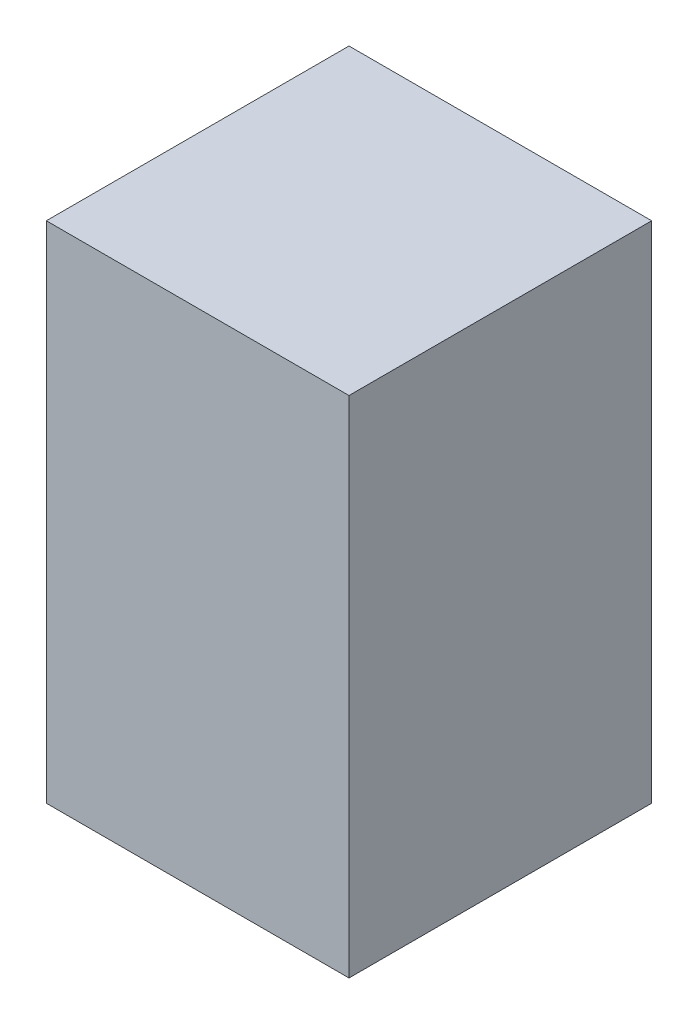
from build123d import *

# Parameters (mm, degrees)
SKETCH3_W           = 30
SKETCH3_H           = 50
BOSS_EXTRUDE1_DEPTH = 30


with BuildPart() as part:
    # Sketch3 → Boss-Extrude1 (new body)
    with BuildSketch(Plane.XY):
        Rectangle(SKETCH3_W, SKETCH3_H)
    extrude(amount=BOSS_EXTRUDE1_DEPTH)


solid = part.part
